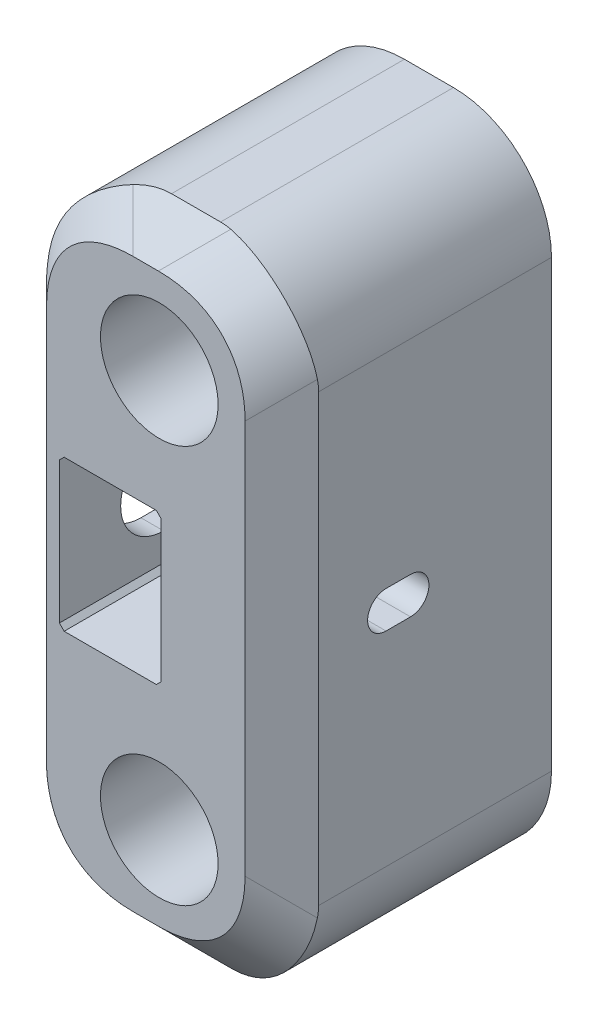
from build123d import *
from build123d.topology import SkipClean

# Parameters (mm, degrees)
SZKIC1_W                        = 20
SZKIC1_H                        = 52.3
SZKIC1_R                        = 2.8
DODANIE_WYCI_GNI_CIE1_DEPTH     = 22
SZKIC2_R                        = 4.8
WYTNIJ_WYCI_GNI_CIE1_DEPTH      = 7
ZAOKR_GLENIE1_R                 = 8
WYTNIJ_WYCI_GNI_CIE2_DEPTH      = 161.813163879
WYTNIJ_WYCI_GNI_CIE2_DEPTH_BACK = 161.813163879
WYTNIJ_WYCI_GNI_CIE3_REACH      = 163.032
SZKIC7_R                        = 2.8
DODANIE_WYCI_GNI_CIE2_DEPTH     = 0.2
SFAZOWANIE1_SIZE                = 3
SFAZOWANIE2_SIZE                = 3
ZAOKR_GLENIE2_R                 = 10
SFAZOWANIE3_SIZE                = 0.8
ZAOKR_GLENIE3_START             = -102
ZAOKR_GLENIE3_DEPTH             = 6.947286026
ZAOKR_GLENIE3_START_2           = 51
ZAOKR_GLENIE3_2_DEPTH           = 6.499237843


with BuildPart() as part:
    # Szkic1 → Dodanie-wyciągnięcie1 (new body)
    with BuildSketch(Plane.XY):
        with Locations((-31.301196691, 132.11386567)):
            Rectangle(SZKIC1_W, SZKIC1_H)
        with Locations((-31.301196691, 148.26386567)):
            Circle(SZKIC1_R, mode=Mode.SUBTRACT)
        with Locations(Location((-31.301196691, 115.96386567, 0), (0, 0, 180))):
            Circle(SZKIC1_R, mode=Mode.SUBTRACT)
        Polygon((-33.860213685, 125.96386567), (-39.063328725, 125.96386567), (-39.451196691, 126.351733636), (-39.451196691, 137.875997705), (-39.063328725, 138.26386567), (-33.860213685, 138.26386567), (-33.560213685, 138.26386567), (-33.042179696, 138.26386567), (-32.742179696, 138.26386567), (-31.539064656, 138.26386567), (-31.151196691, 137.875997705), (-31.151196691, 126.351733636), (-31.539064656, 125.96386567), (-32.742179696, 125.96386567), (-33.042179696, 125.96386567), (-33.560213685, 125.96386567), align=None, mode=Mode.SUBTRACT)
    extrude(amount=DODANIE_WYCI_GNI_CIE1_DEPTH)

    # Szkic2 → Wytnij-wyciągnięcie1 (cut)
    with BuildSketch(Plane.XY.offset(22)):
        with Locations((-31.301196691, 148.26386567)):
            Circle(SZKIC2_R)
        with Locations((-31.301196691, 115.81386567)):
            Circle(SZKIC2_R)
    extrude(amount=-WYTNIJ_WYCI_GNI_CIE1_DEPTH, mode=Mode.SUBTRACT)

    # Zaokrąglenie1
    zaokr_glenie1_edges = [part.edges().sort_by_distance(p)[0] for p in [
        (-41.301196691, 105.96386567, 11),
        (-41.301196691, 158.26386567, 11),
        (-21.301196691, 158.26386567, 11),
        (-21.301196691, 105.96386567, 11),
    ]]
    fillet(zaokr_glenie1_edges, radius=ZAOKR_GLENIE1_R)

    # Szkic4 → Wytnij-wyciągnięcie2 (cut, two sides: drawn at the far end of the back side and taken through both)
    with BuildSketch(Plane(origin=(-39.451196691, 0, 0), x_dir=(0, 0, -1), z_dir=(1, 0, 0)).offset(-WYTNIJ_WYCI_GNI_CIE2_DEPTH_BACK)):
        with BuildLine():
            Line((-13.5, 133.61386567), (-11.5, 133.61386567))
            ThreePointArc((-11.5, 133.61386567), (-10, 132.11386567), (-11.5, 130.61386567))
            Line((-11.5, 130.61386567), (-13.5, 130.61386567))
            ThreePointArc((-13.5, 130.61386567), (-15, 132.11386567), (-13.5, 133.61386567))
        make_face()
    extrude(amount=WYTNIJ_WYCI_GNI_CIE2_DEPTH + WYTNIJ_WYCI_GNI_CIE2_DEPTH_BACK, mode=Mode.SUBTRACT)

    # Szkic6 → Wytnij-wyciągnięcie3 (cut, up to next)
    with BuildSketch(Plane.ZY.offset(41.301196691), mode=Mode.PRIVATE) as wytnij_wyci_gni_cie3_sk1:
        with BuildLine():
            Line((11.5, 128.61386567), (13.5, 128.61386567))
            ThreePointArc((13.5, 128.61386567), (17, 132.11386567), (13.5, 135.61386567))
            Line((13.5, 135.61386567), (11.5, 135.61386567))
            ThreePointArc((11.5, 135.61386567), (8, 132.11386567), (11.5, 128.61386567))
        make_face()
    wytnij_wyci_gni_cie3_tool1 = extrude(wytnij_wyci_gni_cie3_sk1.sketch, amount=-WYTNIJ_WYCI_GNI_CIE3_REACH, mode=Mode.PRIVATE) & part.part
    add(wytnij_wyci_gni_cie3_tool1.solids().sort_by_distance((-41.301197, 132.113866, 12.5))[0], mode=Mode.SUBTRACT)

    # Szkic7 → Dodanie-wyciągnięcie2 (add)
    with BuildSketch(Plane(origin=(0, 0, 0), x_dir=(-1, 0, 0), z_dir=(0, 0, -1))):
        with Locations((31.301196691, 115.96386567)):
            Circle(SZKIC7_R)
        with Locations((31.301196691, 148.26386567)):
            Circle(SZKIC7_R)
        Polygon((31.539064656, 125.96386567), (31.151196691, 126.351733636), (31.151196691, 137.875997705), (31.539064656, 138.26386567), (39.063328725, 138.26386567), (39.451196691, 137.875997705), (39.451196691, 126.351733636), (39.063328725, 125.96386567), align=None)
    extrude(amount=-DODANIE_WYCI_GNI_CIE2_DEPTH)

    # Sfazowanie1
    # the kernel refuses this chamfer: 3 mm, written as the material it takes off along each edge
    with BuildSketch(Plane(origin=(-21.301196691, 157.978914634, 22), x_dir=(0, 0, -1), z_dir=(0, -1, 0))) as sfazowanie1_piece_1:
        Polygon((SFAZOWANIE1_SIZE, 0), (0, -SFAZOWANIE1_SIZE), (0, 0), align=None)
    extrude(amount=51.730097928, mode=Mode.SUBTRACT)

    # Sfazowanie2
    # the kernel refuses this chamfer: 3 mm, written as the material it takes off along each edge
    with BuildSketch(Plane(origin=(-21.586147727, 105.96386567, 22), x_dir=(0, 1, 0), z_dir=(-1, 0, 0)), Plane(origin=(-41.016245655, 158.26386567, 22), x_dir=(0, -1, 0), z_dir=(1, 0, 0))) as sfazowanie2_piece_1:
        Polygon((SFAZOWANIE2_SIZE, 0), (0, SFAZOWANIE2_SIZE), (0, 0), align=None)
    extrude(amount=19.430097928, mode=Mode.SUBTRACT)

    # Zaokrąglenie2
    zaokr_glenie2_edges = [part.edges().sort_by_distance(p)[0] for p in [
        (-23.972769566, 108.635438546, 21.671572875),
        (-23.972769566, 155.592292795, 21.671572875),
    ]]
    fillet(zaokr_glenie2_edges, radius=ZAOKR_GLENIE2_R)

    # Sfazowanie3
    sfazowanie3_edges = [part.edges().sort_by_distance(p)[0] for p in [
        (-40.849705947, 152.913395441, 22),
        (-40.849705947, 111.3143359, 22),
        (-41.301196691, 132.11386567, 22),
    ]]
    chamfer(sfazowanie3_edges, length=SFAZOWANIE3_SIZE)

    # Zaokrąglenie3: read off the stored shape, not the designer's step
    # Zaokrąglenie3 outline → Zaokrąglenie3 (cut)
    with SkipClean():  # the faces are left unmerged after this step: merging them gives an invalid solid
        with BuildSketch(Plane(origin=(0, 0, 0), x_dir=(0.8164965809277239, 0.4082482904638656, -0.40824829046386485), z_dir=(0.5773502691896288, -0.5773502691896248, 0.5773502691896238)).offset(ZAOKR_GLENIE3_START)):
            with BuildLine():
                ThreePointArc((18.448905373, 120.344481475), (22.109159411, 124.004735513), (27.109159411, 125.344481475))
                Line((27.109159411, 125.344481475), (17, 125.344481475))
                Line((17, 125.344481475), (17, 119))
                Line((17, 119), (17.672668632, 119))
                Line((17.672668632, 119), (18.448905373, 120.344481475))
            make_face()
        extrude(amount=ZAOKR_GLENIE3_DEPTH, mode=Mode.SUBTRACT)

    # Zaokr_glenie3 2 outline → Zaokr_glenie3 2 (cut)
    with BuildSketch(Plane(origin=(0, 0, 0), x_dir=(0.816496580927723, -0.4082482904638645, -0.40824829046386735), z_dir=(0.5773502691896298, 0.5773502691896218, 0.5773502691896258)).offset(ZAOKR_GLENIE3_START_2)):
        with BuildLine():
            Line((-91, 61.492739134), (-80.761360202, 61.492739134))
            ThreePointArc((-80.761360202, 61.492739134), (-85.761360202, 62.832485096), (-89.42161424, 66.492739134))
            Line((-89.42161424, 66.492739134), (-90.291831707, 68))
            Line((-90.291831707, 68), (-91, 68))
            Line((-91, 68), (-91, 61.492739134))
        make_face()
    extrude(amount=ZAOKR_GLENIE3_2_DEPTH, mode=Mode.SUBTRACT)


solid = part.part
